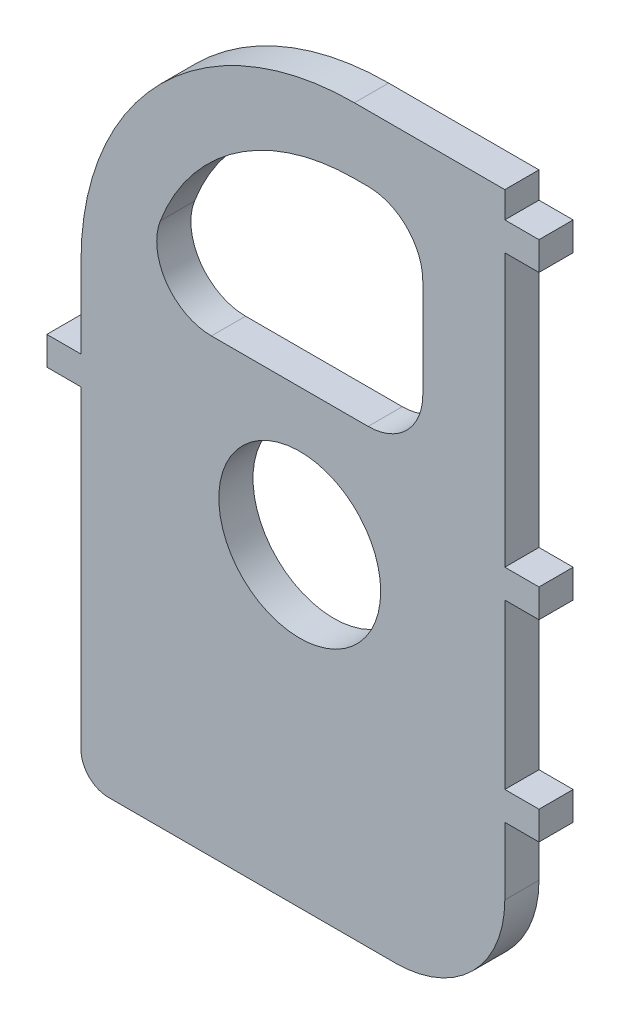
from build123d import *

# Parameters (mm, degrees)
SKETCH1_R              = 3.7592
BOSS_EXTRUDE1_DEPTH    = 1.5875
FILLET1_R              = 5.08
FILLET2_R              = 1.27
WEIGHT_REDUCTION_REACH = 24.437
FILLET3_R              = 2.54


with BuildPart() as part:
    # Sketch1 → Boss-Extrude1 (new body)
    with BuildSketch(Plane.XY):
        with BuildLine():
            Line((11.1125, 17.8308), (9.525, 17.8308))
            Line((9.525, 17.8308), (9.525, 19.05))
            Line((9.525, 19.05), (2.54, 19.05))
            ThreePointArc((2.54, 19.05), (-6.440256121, 15.330256121), (-10.16, 6.35))
            Line((-10.16, 6.35), (-10.16, 2.5908))
            Line((-10.16, 2.5908), (-11.7475, 2.5908))
            Line((-11.7475, 2.5908), (-11.7475, 1.27))
            Line((-11.7475, 1.27), (-10.16, 1.27))
            Line((-10.16, 1.27), (-10.16, -14.605))
            Line((-10.16, -14.605), (9.525, -14.605))
            Line((9.525, -14.605), (9.525, -6.4008))
            Line((9.525, -6.4008), (11.1125, -6.4008))
            Line((11.1125, -6.4008), (11.1125, -5.08))
            Line((11.1125, -5.08), (9.525, -5.08))
            Line((9.525, -5.08), (9.525, 2.54))
            Line((9.525, 2.54), (11.1125, 2.54))
            Line((11.1125, 2.54), (11.1125, 3.8608))
            Line((11.1125, 3.8608), (9.525, 3.8608))
            Line((9.525, 3.8608), (9.525, 16.51))
            Line((9.525, 16.51), (11.1125, 16.51))
            Line((11.1125, 16.51), (11.1125, 17.8308))
        make_face()
        Circle(SKETCH1_R, mode=Mode.SUBTRACT)
    extrude(amount=BOSS_EXTRUDE1_DEPTH)

    # Fillet1
    fillet1_edges = [part.edges().sort_by_distance(p)[0] for p in [
        (9.525, -14.605, 0.79375),
    ]]
    fillet(fillet1_edges, radius=FILLET1_R)

    # Fillet2
    fillet2_edges = [part.edges().sort_by_distance(p)[0] for p in [
        (-10.16, -14.605, 0.79375),
    ]]
    fillet(fillet2_edges, radius=FILLET2_R)

    # Sketch2 → Weight Reduction (cut, up to next)
    with BuildSketch(Plane.XY.offset(1.5875), mode=Mode.PRIVATE) as weight_reduction_sk1:
        with BuildLine():
            Line((-7.112, 6.35), (5.715, 6.35))
            Line((5.715, 6.35), (5.715, 16.002))
            Line((5.715, 16.002), (2.54, 16.002))
            ThreePointArc((2.54, 16.002), (-4.284994652, 13.174994652), (-7.112, 6.35))
        make_face()
    weight_reduction_tool1 = extrude(weight_reduction_sk1.sketch, amount=-WEIGHT_REDUCTION_REACH, mode=Mode.PRIVATE) & part.part
    add(weight_reduction_tool1.solids().sort_by_distance((0.121424, 10.661798, 1.5875))[0], mode=Mode.SUBTRACT)

    # Fillet3
    fillet3_edges = [part.edges().sort_by_distance(p)[0] for p in [
        (5.715, 6.35, 0.79375),
        (-7.112, 6.35, 0.79375),
        (5.715, 16.002, 0.79375),
    ]]
    fillet(fillet3_edges, radius=FILLET3_R)


solid = part.part
